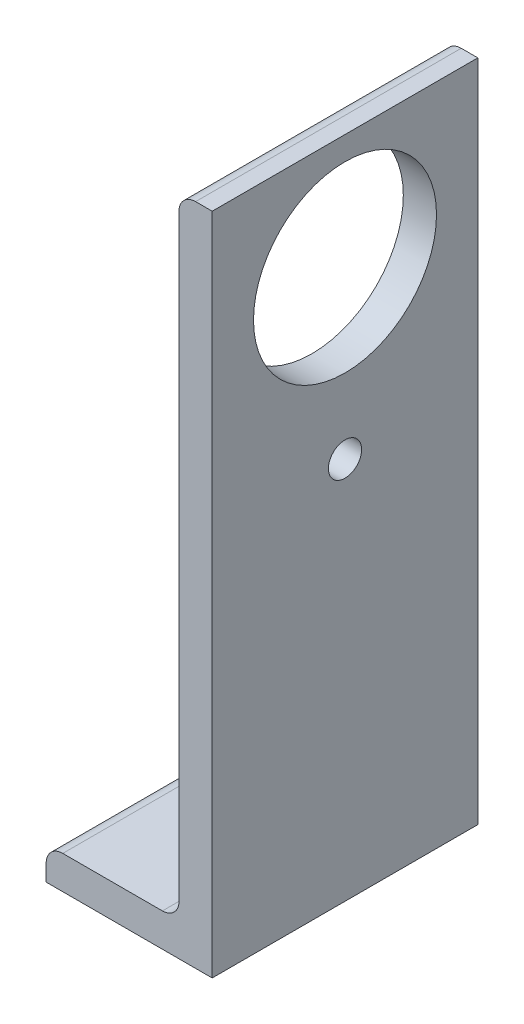
from build123d import *

# Parameters (mm, degrees)
BOSS_EXTRUDE1_DEPTH = 25.4
SKETCH3_R           = 4.765
CUT_EXTRUDE1_DEPTH  = 131.484388434
SKETCH5_R           = 17.5
SKETCH5_R_2         = 3.175
CUT_EXTRUDE2_DEPTH  = 12.7


with BuildPart() as part:
    # Sketch2 → Boss-Extrude1 (new, symmetric)
    with BuildSketch(Plane.XY):
        with BuildLine():
            Line((-15.875, 0), (15.875, 0))
            Line((15.875, 0), (15.875, 127))
            Line((15.875, 127), (12.7, 127))
            ThreePointArc((12.7, 127), (10.45493597, 126.07006403), (9.525, 123.825))
            Line((9.525, 123.825), (9.525, 9.525))
            ThreePointArc((9.525, 9.525), (8.59506403, 7.27993597), (6.35, 6.35))
            Line((6.35, 6.35), (-12.7, 6.35))
            ThreePointArc((-12.7, 6.35), (-14.94506403, 5.42006403), (-15.875, 3.175))
            Line((-15.875, 3.175), (-15.875, 0))
        make_face()
    extrude(amount=BOSS_EXTRUDE1_DEPTH, both=True)

    # Sketch3 → Cut-Extrude1 (cut, through all)
    with BuildSketch(Plane.XZ):
        with Locations((-4.826, 0)):
            Circle(SKETCH3_R)
    extrude(amount=-CUT_EXTRUDE1_DEPTH, mode=Mode.SUBTRACT)

    # Sketch5 → Cut-Extrude2 (cut)
    with BuildSketch(Plane(origin=(15.875, 0, 0), x_dir=(0, 0, -1), z_dir=(1, 0, 0))):
        with Locations((0, 105)):
            Circle(SKETCH5_R)
        with Locations((0, 73.25)):
            Circle(SKETCH5_R_2)
    extrude(amount=-CUT_EXTRUDE2_DEPTH, mode=Mode.SUBTRACT)


solid = part.part
